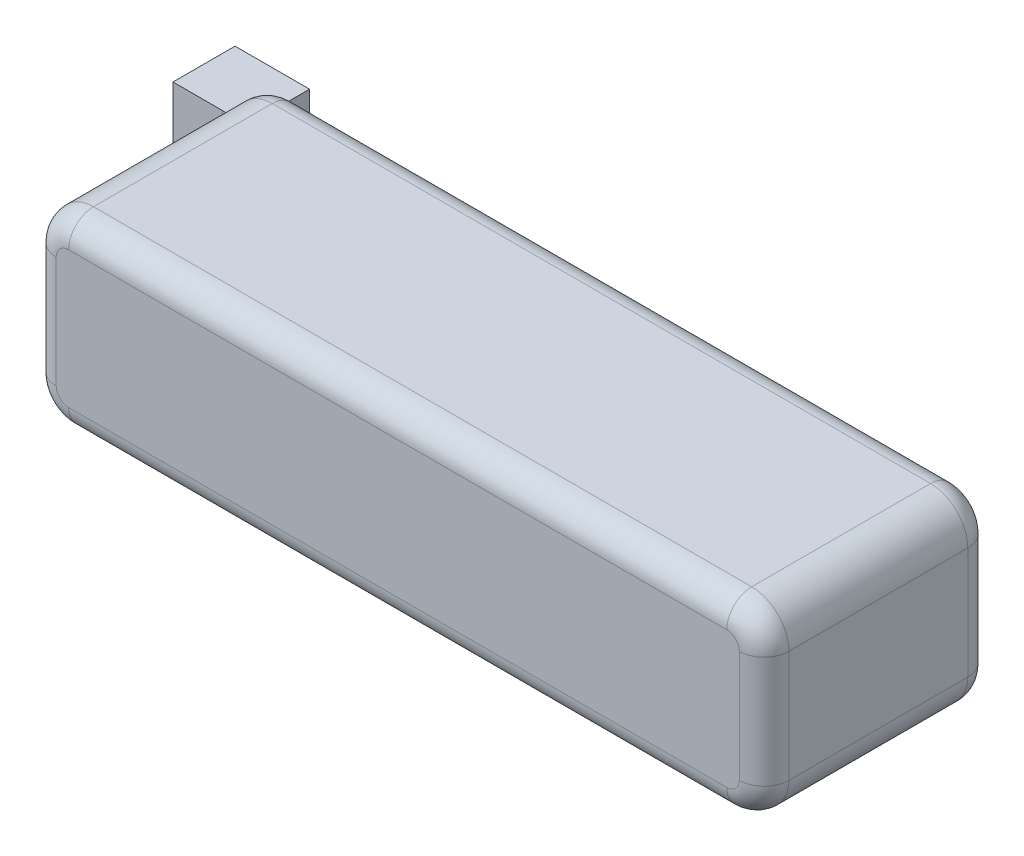
from build123d import *

# Parameters (mm, degrees)
SKETCH1_W           = 74.93
SKETCH1_H           = 23.368
BOSS_EXTRUDE1_DEPTH = 19.05
SKETCH2_W           = 6.35
SKETCH2_H           = 10.16
BOSS_EXTRUDE2_DEPTH = 7.62
FILLET1_R           = 2.54
FILLET2_R           = 3.81
FILLET3_R           = 2.54
FILLET4_R           = 2.54


with BuildPart() as part:
    # Sketch1 → Boss-Extrude1 (new body)
    with BuildSketch(Plane(origin=(0, 0, 0), x_dir=(1, 0, 0), z_dir=(0, 1, 0))):
        with Locations((37.465, -11.684)):
            Rectangle(SKETCH1_W, SKETCH1_H)
    extrude(amount=BOSS_EXTRUDE1_DEPTH)

    # Sketch2 → Boss-Extrude2 (add)
    with BuildSketch(Plane.ZY):
        with Locations((-1.905, 9.525)):
            Rectangle(SKETCH2_W, SKETCH2_H)
    extrude(amount=BOSS_EXTRUDE2_DEPTH)

    # Fillet1
    fillet1_edges = [part.edges().sort_by_distance(p)[0] for p in [
        (0, 9.525, 1.27),
        (0, 9.525, 0),
    ]]
    fillet(fillet1_edges, radius=FILLET1_R)

    # Fillet2
    fillet2_edges = [part.edges().sort_by_distance(p)[0] for p in [
        (0, 19.05, 11.684),
        (74.93, 19.05, 11.684),
        (74.93, 0, 11.684),
        (0, 0, 11.684),
    ]]
    fillet(fillet2_edges, radius=FILLET2_R)

    # Fillet3
    fillet3_edges = [part.edges().sort_by_distance(p)[0] for p in [
        (1.115923164, 1.115923164, 23.368),
        (0, 9.525, 23.368),
        (1.115923164, 17.934076836, 23.368),
        (37.465, 19.05, 23.368),
        (73.814076836, 17.934076836, 23.368),
        (74.93, 9.525, 23.368),
        (73.814076836, 1.115923164, 23.368),
        (37.465, 0, 23.368),
    ]]
    fillet(fillet3_edges, radius=FILLET3_R)

    # Fillet4
    fillet4_edges = [part.edges().sort_by_distance(p)[0] for p in [
        (0, 14.9225, 0),
        (1.115923164, 17.934076836, 0),
        (37.465, 19.05, 0),
        (73.814076836, 17.934076836, 0),
        (74.93, 9.525, 0),
        (73.814076836, 1.115923164, 0),
        (0, 4.1275, 0),
        (1.115923164, 1.115923164, 0),
        (37.465, 0, 0),
    ]]
    fillet(fillet4_edges, radius=FILLET4_R)


solid = part.part
